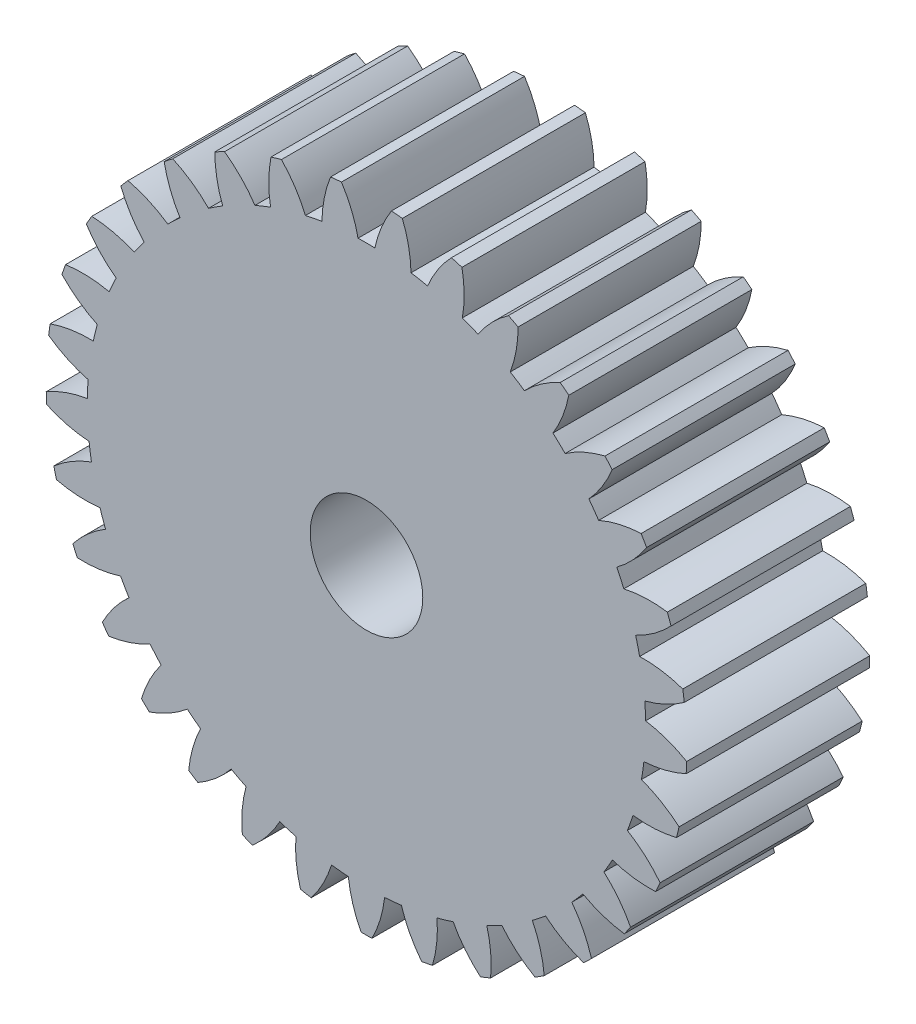
from build123d import *

# Parameters (mm, degrees)
CROQUIS1_R              = 3.075
SALIENTE_EXTRUIR1_DEPTH = 10


with BuildPart() as part:
    # Croquis1 → Saliente-Extruir1 (new body)
    with BuildSketch(Plane.XY):
        with BuildLine():
            ThreePointArc((2.432853295, 15.05367815), (2.30290802, 16.243278252), (1.96029505, 17.389860359))
            ThreePointArc((1.96029505, 17.389860359), (1.663480758, 17.420758645), (1.366182748, 17.446591206))
            ThreePointArc((1.366182748, 17.446591206), (0.812769149, 16.385569262), (0.460038855, 15.242059088))
            ThreePointArc((0.460038855, 15.242059088), (0, 15.249), (-0.460038855, 15.242059088))
            ThreePointArc((-0.460038855, 15.242059088), (-0.812769149, 16.385569262), (-1.366182748, 17.446591206))
            ThreePointArc((-1.366182748, 17.446591206), (-1.663480758, 17.420758645), (-1.96029505, 17.389860359))
            ThreePointArc((-1.96029505, 17.389860359), (-2.30290802, 16.243278252), (-2.432853295, 15.05367815))
            ThreePointArc((-2.432853295, 15.05367815), (-2.885892225, 14.973430705), (-3.336304003, 14.879552298))
            ThreePointArc((-3.336304003, 14.879552298), (-3.899070724, 15.935643106), (-4.643283141, 16.872756789))
            ThreePointArc((-4.643283141, 16.872756789), (-4.930319745, 16.791127038), (-5.215922677, 16.704614651))
            ThreePointArc((-5.215922677, 16.704614651), (-5.335352094, 15.513912845), (-5.237815789, 14.321218061))
            ThreePointArc((-5.237815789, 14.321218061), (-5.667480786, 14.156682611), (-6.091986431, 13.97925972))
            ThreePointArc((-6.091986431, 13.97925972), (-6.844449724, 14.909761289), (-7.752563184, 15.689096981))
            ThreePointArc((-7.752563184, 15.689096981), (-8.01896413, 15.554620351), (-8.283033268, 15.415620645))
            ThreePointArc((-8.283033268, 15.415620645), (-8.174962642, 14.223834206), (-7.853469973, 13.071151838))
            ThreePointArc((-7.853469973, 13.071151838), (-8.244231825, 12.828275122), (-8.627488597, 12.573720273))
            ThreePointArc((-8.627488597, 12.573720273), (-9.542452478, 13.345001851), (-10.581645394, 13.93839233))
            ThreePointArc((-10.581645394, 13.93839233), (-10.817782259, 13.755929158), (-11.050773456, 13.569465945))
            ThreePointArc((-11.050773456, 13.569465945), (-10.71910874, 12.41966914), (-10.18527929, 11.348660131))
            ThreePointArc((-10.18527929, 11.348660131), (-10.523014846, 11.036220347), (-10.851170847, 10.713733815))
            ThreePointArc((-10.851170847, 10.713733815), (-11.895566137, 11.297919277), (-13.02827937, 11.683917864))
            ThreePointArc((-13.02827937, 11.683917864), (-13.225617551, 11.460062844), (-13.419109899, 11.23287539))
            ThreePointArc((-13.419109899, 11.23287539), (-12.87583832, 10.166624871), (-12.148966076, 9.215998279))
            ThreePointArc((-12.148966076, 9.215998279), (-12.421468693, 8.845287814), (-12.68266351, 8.466525102))
            ThreePointArc((-12.68266351, 8.466525102), (-13.818743042, 8.842500464), (-15.004037384, 9.007156165))
            ThreePointArc((-15.004037384, 9.007156165), (-15.155444566, 8.75), (-15.302444747, 8.490299451))
            ThreePointArc((-15.302444747, 8.490299451), (-14.567201556, 7.546132291), (-13.673557575, 6.750246236))
            ThreePointArc((-13.673557575, 6.750246236), (-13.870978297, 6.334663533), (-14.055771669, 5.913314113))
            ThreePointArc((-14.055771669, 5.913314113), (-15.242474569, 6.067490645), (-16.437510395, 6.004852374))
            ThreePointArc((-16.437510395, 6.004852374), (-16.537514328, 5.723689358), (-16.632709371, 5.44086197))
            ThreePointArc((-16.632709371, 5.44086197), (-15.732068173, 4.652902829), (-14.703951076, 4.040522707))
            ThreePointArc((-14.703951076, 4.040522707), (-14.819154605, 3.595088008), (-14.920867618, 3.146380544))
            ThreePointArc((-14.920867618, 3.146380544), (-16.115303351, 3.073185905), (-17.276888952, 2.785517572))
            ThreePointArc((-17.276888952, 2.785517572), (-17.321875233, 2.49050967), (-17.361824543, 2.19477756))
            ThreePointArc((-17.361824543, 2.19477756), (-16.328336856, 1.591505335), (-15.202905475, 1.18476416))
            ThreePointArc((-15.202905475, 1.18476416), (-15.231728055, 0.725576634), (-15.246684535, 0.265728585))
            ThreePointArc((-15.246684535, 0.265728585), (-16.405683083, -0.03219178), (-17.491835728, -0.534493092))
            ThreePointArc((-17.491835728, -0.534493092), (-17.480178436, -0.832683527), (-17.46343814, -1.130631829))
            ThreePointArc((-17.46343814, -1.130631829), (-16.334456903, -1.527413308), (-15.152387259, -1.713814851))
            ThreePointArc((-15.152387259, -1.713814851), (-15.093787167, -2.170158969), (-15.021446549, -2.624527497))
            ThreePointArc((-15.021446549, -2.624527497), (-16.103118683, -3.136405971), (-17.074581986, -3.835185783))
            ThreePointArc((-17.074581986, -3.835185783), (-17.006702446, -4.125781371), (-16.933877582, -4.415177237))
            ThreePointArc((-16.933877582, -4.415177237), (-15.750207118, -4.591127255), (-14.554222289, -4.550452128))
            ThreePointArc((-14.554222289, -4.550452128), (-14.410317485, -4.987459373), (-14.253294346, -5.419926318))
            ThreePointArc((-14.253294346, -5.419926318), (-15.218545617, -6.127262278), (-16.040208364, -6.997264868))
            ThreePointArc((-16.040208364, -6.997264868), (-15.918559919, -7.269762728), (-15.792282567, -7.540146637))
            ThreePointArc((-15.792282567, -7.540146637), (-14.596703811, -7.4889059), (-13.430029804, -7.222624209))
            ThreePointArc((-13.430029804, -7.222624209), (-13.206021382, -7.6245), (-12.969990949, -8.01943488))
            ThreePointArc((-12.969990949, -8.01943488), (-13.783934661, -8.896663362), (-14.42609982, -9.906444569))
            ThreePointArc((-14.42609982, -9.906444569), (-14.255079161, -10.150995918), (-14.079913315, -10.392595492))
            ThreePointArc((-14.079913315, -10.392595492), (-12.915637597, -10.116015974), (-11.820441051, -9.633751832))
            ThreePointArc((-11.820441051, -9.633751832), (-11.524425259, -9.985971332), (-11.217918286, -10.32910017))
            ThreePointArc((-11.217918286, -10.32910017), (-11.851136393, -11.344515851), (-12.290594441, -12.457579552))
            ThreePointArc((-12.290594441, -12.457579552), (-12.076382701, -12.665345667), (-11.85865931, -12.869428868))
            ThreePointArc((-11.85865931, -12.869428868), (-10.767766589, -12.377506874), (-9.78363076, -11.696690564))
            ThreePointArc((-9.78363076, -11.696690564), (-9.426306381, -11.986523642), (-9.060400828, -12.265444869))
            ThreePointArc((-9.060400828, -12.265444869), (-9.490007178, -13.382347981), (-9.710874956, -14.558465152))
            ThreePointArc((-9.710874956, -14.558465152), (-9.461214305, -14.721936825), (-9.20880246, -14.881127553))
            ThreePointArc((-9.20880246, -14.881127553), (-8.230720441, -14.191642426), (-7.393214562, -13.336880424))
            ThreePointArc((-7.393214562, -13.336880424), (-6.98749623, -13.553851757), (-6.575416878, -13.758484433))
            ThreePointArc((-6.575416878, -13.758484433), (-6.785884378, -14.936507186), (-6.780179149, -16.13316989))
            ThreePointArc((-6.780179149, -16.13316989), (-6.504092974, -16.246438828), (-6.226115496, -16.354983517))
            ThreePointArc((-6.226115496, -16.354983517), (-5.396194611, -15.492855045), (-4.735588328, -14.495040676))
            ThreePointArc((-4.735588328, -14.495040676), (-4.296139759, -14.631308355), (-3.852780229, -14.754256522))
            ThreePointArc((-3.852780229, -14.754256522), (-3.836502035, -15.950822106), (-3.604430001, -17.124779834))
            ThreePointArc((-3.604430001, -17.124779834), (-3.311896776, -17.183752202), (-3.018400496, -17.237727764))
            ThreePointArc((-3.018400496, -17.237727764), (-2.366636249, -16.234115516), (-1.906805592, -15.129312391))
            ThreePointArc((-1.906805592, -15.129312391), (-1.449509604, -15.179951347), (-0.990894065, -15.216771338))
            ThreePointArc((-0.990894065, -15.216771338), (-0.748458514, -16.388632755), (-0.298407363, -17.497455616))
            ThreePointArc((-0.298407363, -17.497455616), (0, -17.5), (0.298407363, -17.497455616))
            ThreePointArc((0.298407363, -17.497455616), (0.748458514, -16.388632755), (0.990894065, -15.216771338))
            ThreePointArc((0.990894065, -15.216771338), (1.449509604, -15.179951347), (1.906805592, -15.129312391))
            ThreePointArc((1.906805592, -15.129312391), (2.366636249, -16.234115516), (3.018400496, -17.237727764))
            ThreePointArc((3.018400496, -17.237727764), (3.311896776, -17.183752202), (3.604430001, -17.124779834))
            ThreePointArc((3.604430001, -17.124779834), (3.836502035, -15.950822106), (3.852780229, -14.754256522))
            ThreePointArc((3.852780229, -14.754256522), (4.296139759, -14.631308355), (4.735588328, -14.495040676))
            ThreePointArc((4.735588328, -14.495040676), (5.396194611, -15.492855045), (6.226115496, -16.354983517))
            ThreePointArc((6.226115496, -16.354983517), (6.504092974, -16.246438828), (6.780179149, -16.13316989))
            ThreePointArc((6.780179149, -16.13316989), (6.785884378, -14.936507186), (6.575416878, -13.758484433))
            ThreePointArc((6.575416878, -13.758484433), (6.98749623, -13.553851757), (7.393214562, -13.336880424))
            ThreePointArc((7.393214562, -13.336880424), (8.230720441, -14.191642426), (9.20880246, -14.881127553))
            ThreePointArc((9.20880246, -14.881127553), (9.461214305, -14.721936825), (9.710874956, -14.558465152))
            ThreePointArc((9.710874956, -14.558465152), (9.490007178, -13.382347981), (9.060400828, -12.265444869))
            ThreePointArc((9.060400828, -12.265444869), (9.426306381, -11.986523642), (9.78363076, -11.696690564))
            ThreePointArc((9.78363076, -11.696690564), (10.767766589, -12.377506874), (11.85865931, -12.869428868))
            ThreePointArc((11.85865931, -12.869428868), (12.076382701, -12.665345667), (12.290594441, -12.457579552))
            ThreePointArc((12.290594441, -12.457579552), (11.851136393, -11.344515851), (11.217918286, -10.32910017))
            ThreePointArc((11.217918286, -10.32910017), (11.524425259, -9.985971332), (11.820441051, -9.633751832))
            ThreePointArc((11.820441051, -9.633751832), (12.915637597, -10.116015974), (14.079913315, -10.392595492))
            ThreePointArc((14.079913315, -10.392595492), (14.255079161, -10.150995918), (14.42609982, -9.906444569))
            ThreePointArc((14.42609982, -9.906444569), (13.783934661, -8.896663362), (12.969990949, -8.01943488))
            ThreePointArc((12.969990949, -8.01943488), (13.206021382, -7.6245), (13.430029804, -7.222624209))
            ThreePointArc((13.430029804, -7.222624209), (14.596703811, -7.4889059), (15.792282567, -7.540146637))
            ThreePointArc((15.792282567, -7.540146637), (15.918559919, -7.269762728), (16.040208364, -6.997264868))
            ThreePointArc((16.040208364, -6.997264868), (15.218545617, -6.127262278), (14.253294346, -5.419926318))
            ThreePointArc((14.253294346, -5.419926318), (14.410317485, -4.987459373), (14.554222289, -4.550452128))
            ThreePointArc((14.554222289, -4.550452128), (15.750207118, -4.591127255), (16.933877582, -4.415177237))
            ThreePointArc((16.933877582, -4.415177237), (17.006702446, -4.125781371), (17.074581986, -3.835185783))
            ThreePointArc((17.074581986, -3.835185783), (16.103118683, -3.136405971), (15.021446549, -2.624527497))
            ThreePointArc((15.021446549, -2.624527497), (15.093787167, -2.170158969), (15.152387259, -1.713814851))
            ThreePointArc((15.152387259, -1.713814851), (16.334456903, -1.527413308), (17.46343814, -1.130631829))
            ThreePointArc((17.46343814, -1.130631829), (17.480178436, -0.832683527), (17.491835728, -0.534493092))
            ThreePointArc((17.491835728, -0.534493092), (16.405683083, -0.03219178), (15.246684535, 0.265728585))
            ThreePointArc((15.246684535, 0.265728585), (15.231728055, 0.725576634), (15.202905475, 1.18476416))
            ThreePointArc((15.202905475, 1.18476416), (16.328336856, 1.591505335), (17.361824543, 2.19477756))
            ThreePointArc((17.361824543, 2.19477756), (17.321875233, 2.49050967), (17.276888952, 2.785517572))
            ThreePointArc((17.276888952, 2.785517572), (16.115303351, 3.073185905), (14.920867618, 3.146380544))
            ThreePointArc((14.920867618, 3.146380544), (14.819154605, 3.595088008), (14.703951076, 4.040522707))
            ThreePointArc((14.703951076, 4.040522707), (15.732068173, 4.652902829), (16.632709371, 5.44086197))
            ThreePointArc((16.632709371, 5.44086197), (16.537514328, 5.723689358), (16.437510395, 6.004852374))
            ThreePointArc((16.437510395, 6.004852374), (15.242474569, 6.067490645), (14.055771669, 5.913314113))
            ThreePointArc((14.055771669, 5.913314113), (13.870978297, 6.334663533), (13.673557575, 6.750246236))
            ThreePointArc((13.673557575, 6.750246236), (14.567201556, 7.546132291), (15.302444747, 8.490299451))
            ThreePointArc((15.302444747, 8.490299451), (15.155444566, 8.75), (15.004037384, 9.007156165))
            ThreePointArc((15.004037384, 9.007156165), (13.818743042, 8.842500464), (12.68266351, 8.466525102))
            ThreePointArc((12.68266351, 8.466525102), (12.421468693, 8.845287814), (12.148966076, 9.215998279))
            ThreePointArc((12.148966076, 9.215998279), (12.87583832, 10.166624871), (13.419109899, 11.23287539))
            ThreePointArc((13.419109899, 11.23287539), (13.225617551, 11.460062844), (13.02827937, 11.683917864))
            ThreePointArc((13.02827937, 11.683917864), (11.895566137, 11.297919277), (10.851170847, 10.713733815))
            ThreePointArc((10.851170847, 10.713733815), (10.523014846, 11.036220347), (10.18527929, 11.348660131))
            ThreePointArc((10.18527929, 11.348660131), (10.71910874, 12.41966914), (11.050773456, 13.569465945))
            ThreePointArc((11.050773456, 13.569465945), (10.817782259, 13.755929158), (10.581645394, 13.93839233))
            ThreePointArc((10.581645394, 13.93839233), (9.542452478, 13.345001851), (8.627488597, 12.573720273))
            ThreePointArc((8.627488597, 12.573720273), (8.244231825, 12.828275122), (7.853469973, 13.071151838))
            ThreePointArc((7.853469973, 13.071151838), (8.174962642, 14.223834206), (8.283033268, 15.415620645))
            ThreePointArc((8.283033268, 15.415620645), (8.01896413, 15.554620351), (7.752563184, 15.689096981))
            ThreePointArc((7.752563184, 15.689096981), (6.844449724, 14.909761289), (6.091986431, 13.97925972))
            ThreePointArc((6.091986431, 13.97925972), (5.667480786, 14.156682611), (5.237815789, 14.321218061))
            ThreePointArc((5.237815789, 14.321218061), (5.335352094, 15.513912845), (5.215922677, 16.704614651))
            ThreePointArc((5.215922677, 16.704614651), (4.930319745, 16.791127038), (4.643283141, 16.872756789))
            ThreePointArc((4.643283141, 16.872756789), (3.899070724, 15.935643106), (3.336304003, 14.879552298))
            ThreePointArc((3.336304003, 14.879552298), (2.885892225, 14.973430705), (2.432853295, 15.05367815))
        make_face()
        Circle(CROQUIS1_R, mode=Mode.SUBTRACT)
    extrude(amount=SALIENTE_EXTRUIR1_DEPTH)


solid = part.part
